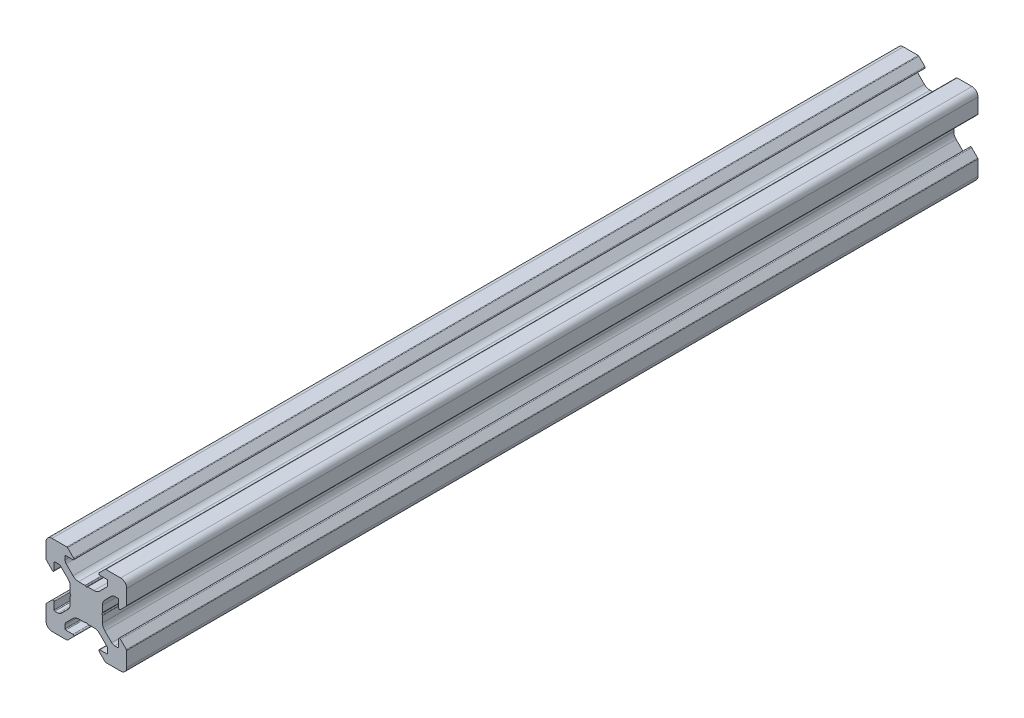
from build123d import *

# Parameters (mm, degrees)
EXTRUDE_1_DEPTH = 211


# Read off the part's stored shape, not the designer's step: 222 Конструкционный профиль 20х20-1-surface1
with BuildPart() as part:
    # Эскиз1 → Бобышка-Вытянуть1 (new body)
    with BuildSketch(Plane.XY):
        with BuildLine():
            Line((-3.945217202, 0.181521503), (-3.8, 0))
            Line((-3.8, 0), (-3.945217202, -0.181521503))
            ThreePointArc((-3.945217202, -0.181521503), (-3.98590708, -0.254943529), (-4, -0.337695265))
            Line((-4, -0.337695265), (-4, -1.898780669))
            ThreePointArc((-4, -1.898780669), (-4.152240935, -2.664147534), (-4.585786438, -3.312994231))
            Line((-4.585786438, -3.312994231), (-6.279898987, -5.007106781))
            ThreePointArc((-6.279898987, -5.007106781), (-6.604322336, -5.223879533), (-6.987005769, -5.3))
            Line((-6.987005769, -5.3), (-7.8, -5.3))
            ThreePointArc((-7.8, -5.3), (-7.941421356, -5.241421356), (-8, -5.1))
            Line((-8, -5.1), (-8, -3.33))
            ThreePointArc((-8, -3.33), (-8.154329142, -3.099030117), (-8.426776695, -3.153223305))
            Line((-8.426776695, -3.153223305), (-9.926776695, -4.653223305))
            ThreePointArc((-9.926776695, -4.653223305), (-9.980969883, -4.734329142), (-10, -4.83))
            Line((-10, -4.83), (-10, -8.5))
            ThreePointArc((-10, -8.5), (-9.560660172, -9.560660172), (-8.5, -10))
            Line((-8.5, -10), (-4.83, -10))
            ThreePointArc((-4.83, -10), (-4.734329142, -9.980969883), (-4.653223305, -9.926776695))
            Line((-4.653223305, -9.926776695), (-3.153223305, -8.426776695))
            ThreePointArc((-3.153223305, -8.426776695), (-3.099030117, -8.154329142), (-3.33, -8))
            Line((-3.33, -8), (-5.1, -8))
            ThreePointArc((-5.1, -8), (-5.241421356, -7.941421356), (-5.3, -7.8))
            Line((-5.3, -7.8), (-5.3, -6.987005769))
            ThreePointArc((-5.3, -6.987005769), (-5.223879533, -6.604322336), (-5.007106781, -6.279898987))
            Line((-5.007106781, -6.279898987), (-3.312994231, -4.585786438))
            ThreePointArc((-3.312994231, -4.585786438), (-2.664147534, -4.152240935), (-1.898780669, -4))
            Line((-1.898780669, -4), (-0.337695265, -4))
            ThreePointArc((-0.337695265, -4), (-0.254943529, -3.98590708), (-0.181521503, -3.945217202))
            Line((-0.181521503, -3.945217202), (0, -3.8))
            Line((0, -3.8), (0.181521503, -3.945217202))
            ThreePointArc((0.181521503, -3.945217202), (0.254943529, -3.98590708), (0.337695265, -4))
            Line((0.337695265, -4), (1.898780669, -4))
            ThreePointArc((1.898780669, -4), (2.664147534, -4.152240935), (3.312994231, -4.585786438))
            Line((3.312994231, -4.585786438), (5.007106781, -6.279898987))
            ThreePointArc((5.007106781, -6.279898987), (5.223879533, -6.604322336), (5.3, -6.987005769))
            Line((5.3, -6.987005769), (5.3, -7.8))
            ThreePointArc((5.3, -7.8), (5.241421356, -7.941421356), (5.1, -8))
            Line((5.1, -8), (3.33, -8))
            ThreePointArc((3.33, -8), (3.099030117, -8.154329142), (3.153223305, -8.426776695))
            Line((3.153223305, -8.426776695), (4.653223305, -9.926776695))
            ThreePointArc((4.653223305, -9.926776695), (4.734329142, -9.980969883), (4.83, -10))
            Line((4.83, -10), (8.5, -10))
            ThreePointArc((8.5, -10), (9.560660172, -9.560660172), (10, -8.5))
            Line((10, -8.5), (10, -4.83))
            ThreePointArc((10, -4.83), (9.980969883, -4.734329142), (9.926776695, -4.653223305))
            Line((9.926776695, -4.653223305), (8.426776695, -3.153223305))
            ThreePointArc((8.426776695, -3.153223305), (8.154329142, -3.099030117), (8, -3.33))
            Line((8, -3.33), (8, -5.1))
            ThreePointArc((8, -5.1), (7.941421356, -5.241421356), (7.8, -5.3))
            Line((7.8, -5.3), (6.987005769, -5.3))
            ThreePointArc((6.987005769, -5.3), (6.604322336, -5.223879533), (6.279898987, -5.007106781))
            Line((6.279898987, -5.007106781), (4.585786438, -3.312994231))
            ThreePointArc((4.585786438, -3.312994231), (4.152240935, -2.664147534), (4, -1.898780669))
            Line((4, -1.898780669), (4, -0.337695265))
            ThreePointArc((4, -0.337695265), (3.98590708, -0.254943529), (3.945217202, -0.181521503))
            Line((3.945217202, -0.181521503), (3.8, 0))
            Line((3.8, 0), (3.945217202, 0.181521503))
            ThreePointArc((3.945217202, 0.181521503), (3.98590708, 0.254943529), (4, 0.337695265))
            Line((4, 0.337695265), (4, 1.898780669))
            ThreePointArc((4, 1.898780669), (4.152240935, 2.664147534), (4.585786438, 3.312994231))
            Line((4.585786438, 3.312994231), (6.279898987, 5.007106781))
            ThreePointArc((6.279898987, 5.007106781), (6.604322336, 5.223879533), (6.987005769, 5.3))
            Line((6.987005769, 5.3), (7.8, 5.3))
            ThreePointArc((7.8, 5.3), (7.941421356, 5.241421356), (8, 5.1))
            Line((8, 5.1), (8, 3.33))
            ThreePointArc((8, 3.33), (8.154329142, 3.099030117), (8.426776695, 3.153223305))
            Line((8.426776695, 3.153223305), (9.926776695, 4.653223305))
            ThreePointArc((9.926776695, 4.653223305), (9.980969883, 4.734329142), (10, 4.83))
            Line((10, 4.83), (10, 8.5))
            ThreePointArc((10, 8.5), (9.560660172, 9.560660172), (8.5, 10))
            Line((8.5, 10), (4.83, 10))
            ThreePointArc((4.83, 10), (4.734329142, 9.980969883), (4.653223305, 9.926776695))
            Line((4.653223305, 9.926776695), (3.153223305, 8.426776695))
            ThreePointArc((3.153223305, 8.426776695), (3.099030117, 8.154329142), (3.33, 8))
            Line((3.33, 8), (5.1, 8))
            ThreePointArc((5.1, 8), (5.241421356, 7.941421356), (5.3, 7.8))
            Line((5.3, 7.8), (5.3, 6.987005769))
            ThreePointArc((5.3, 6.987005769), (5.223879533, 6.604322336), (5.007106781, 6.279898987))
            Line((5.007106781, 6.279898987), (3.312994231, 4.585786438))
            ThreePointArc((3.312994231, 4.585786438), (2.664147534, 4.152240935), (1.898780669, 4))
            Line((1.898780669, 4), (0.337695265, 4))
            ThreePointArc((0.337695265, 4), (0.254943529, 3.98590708), (0.181521503, 3.945217202))
            Line((0.181521503, 3.945217202), (0, 3.8))
            Line((0, 3.8), (-0.181521503, 3.945217202))
            ThreePointArc((-0.181521503, 3.945217202), (-0.254943529, 3.98590708), (-0.337695265, 4))
            Line((-0.337695265, 4), (-1.898780669, 4))
            ThreePointArc((-1.898780669, 4), (-2.664147534, 4.152240935), (-3.312994231, 4.585786438))
            Line((-3.312994231, 4.585786438), (-5.007106781, 6.279898987))
            ThreePointArc((-5.007106781, 6.279898987), (-5.223879533, 6.604322336), (-5.3, 6.987005769))
            Line((-5.3, 6.987005769), (-5.3, 7.8))
            ThreePointArc((-5.3, 7.8), (-5.241421356, 7.941421356), (-5.1, 8))
            Line((-5.1, 8), (-3.33, 8))
            ThreePointArc((-3.33, 8), (-3.099030117, 8.154329142), (-3.153223305, 8.426776695))
            Line((-3.153223305, 8.426776695), (-4.653223305, 9.926776695))
            ThreePointArc((-4.653223305, 9.926776695), (-4.734329142, 9.980969883), (-4.83, 10))
            Line((-4.83, 10), (-8.5, 10))
            ThreePointArc((-8.5, 10), (-9.560660172, 9.560660172), (-10, 8.5))
            Line((-10, 8.5), (-10, 4.83))
            ThreePointArc((-10, 4.83), (-9.980969883, 4.734329142), (-9.926776695, 4.653223305))
            Line((-9.926776695, 4.653223305), (-8.426776695, 3.153223305))
            ThreePointArc((-8.426776695, 3.153223305), (-8.154329142, 3.099030117), (-8, 3.33))
            Line((-8, 3.33), (-8, 5.1))
            ThreePointArc((-8, 5.1), (-7.941421356, 5.241421356), (-7.8, 5.3))
            Line((-7.8, 5.3), (-6.987005769, 5.3))
            ThreePointArc((-6.987005769, 5.3), (-6.604322336, 5.223879533), (-6.279898987, 5.007106781))
            Line((-6.279898987, 5.007106781), (-4.585786438, 3.312994231))
            ThreePointArc((-4.585786438, 3.312994231), (-4.152240935, 2.664147534), (-4, 1.898780669))
            Line((-4, 1.898780669), (-4, 0.337695265))
            ThreePointArc((-4, 0.337695265), (-3.98590708, 0.254943529), (-3.945217202, 0.181521503))
        make_face()
    extrude(amount=EXTRUDE_1_DEPTH)


solid = part.part
